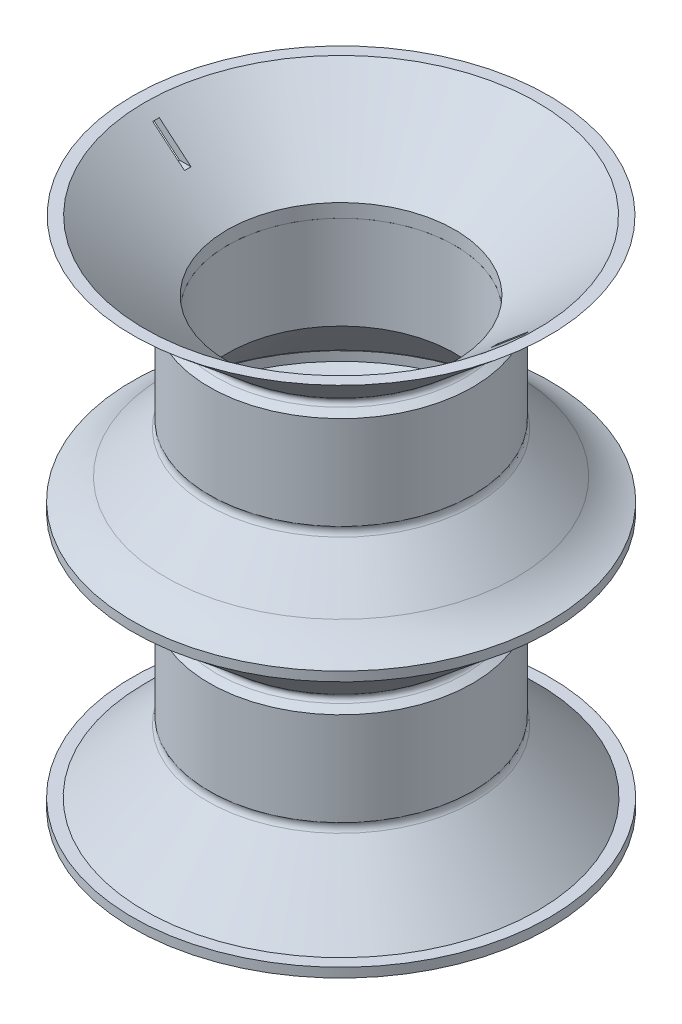
from build123d import *

# Parameters (mm, degrees)
ACTIVE_FILLET_R     = 0.5
SKETCH11_R          = 14.103676921920666
SKETCH11_R_2        = 12.180725781348816
COLLAR_DEPTH        = 10
PASSIVE_FILLET_R    = 0.8
SKETCH15_R          = 22.29457906148835
SKETCH15_R_2        = 19.722102711916126
BOSS_EXTRUDE2_DEPTH = 1
SKETCH18_W          = 3.727866184859466
SKETCH18_H          = 0.7
CIRPATTERN1_COUNT   = 2
FILLET1_R           = 10


with BuildPart() as part:
    # Sketch1 → Main Active (revolve)
    with BuildSketch(Plane.XY):
        Polygon((-0.44430417046757187, 0), (-9.97833291122136, 8), (-8.733753849733018, 8), (0.08552036891816808, 0.5997502558785777), (0.08552036891816808, -0.8481847341285212), (-1.8374307716536824, -0.8481847341285211), align=None)
    revolve(axis=Axis((12.266246150266982, 7.609018032819944, 0), (1.1e-16, -1, 0)))

    # Active fillet
    active_fillet_edges = [part.edges().sort_by_distance(p)[0] for p in [
        (24.976796471001535, 3.23e-15, -1.56e-15),
    ]]
    fillet(active_fillet_edges, radius=ACTIVE_FILLET_R)

    # Cut-Sweep2: sweep along a path in Sketch19
    with BuildLine(Plane(origin=(-0.18357578046802644, -0.2187770958860591, 2e-17), x_dir=(-0.7660444431189819, 0.6427876096865347, 0), z_dir=(-0.6427876096865347, -0.7660444431189819, 0))) as cut_sweep2_path:
        Line((11.230423528864234, 1.22e-15), (6.789896246932316, 1.18e-15))
    # Sketch18 → Cut-Sweep2 (sweep, cut)
    with BuildSketch(Plane(origin=(-8e-16, 7.000000000000001, 0), x_dir=(1, 1.1e-16, 0), z_dir=(-1.1e-16, 1, 0))):
        with Locations((-8.450194980560173, 0)):
            Rectangle(SKETCH18_W, SKETCH18_H)
    cut_sweep2 = sweep(path=cut_sweep2_path.line, mode=Mode.SUBTRACT)

    # CirPattern1: Cut-Sweep2 ×2 about axis
    cirpattern1_axis = Axis((12.266246150266982, 8.000000000000002, 0), (-1.1e-16, 1, 0))
    for i in range(1, CIRPATTERN1_COUNT):
        add(cut_sweep2.rotate(cirpattern1_axis, i * 360 / CIRPATTERN1_COUNT), mode=Mode.SUBTRACT)


with BuildPart() as body_2:
    # Sketch11 → collar (new body)
    with BuildSketch(Plane.XZ.offset(0.848184734128521)):
        with Locations((12.266246150266984, 0)):
            Circle(SKETCH11_R)
        with Locations((12.266246150266984, 0)):
            Circle(SKETCH11_R_2, mode=Mode.SUBTRACT)
    extrude(amount=COLLAR_DEPTH)

    # Sketch14 → Passive Element (revolve)
    with BuildSketch(Plane.XY, mode=Mode.PRIVATE) as passive_element_sk:
        Polygon((-1.1589875659701498, -10.848184734128521), (-8.766364496537454, -18.455561664695857), (-7.521856561649136, -18.45556166469586), (0.08552036891816897, -10.848184734128521), align=None)
    revolve(passive_element_sk.sketch.rotate(Axis((12.266246150266984, -19.969844330252183, 0), (-1.2e-16, 1, 0)), 180), axis=Axis((12.266246150266984, -19.969844330252183, 0), (-1.2e-16, 1, 0)))

    # Passive Fillet
    # the kernel refuses this fillet: 0.8 mm, written as the material it adds along each edge
    with BuildSketch(Plane(origin=(12.266246150266982, -10.84818473412852, 0), x_dir=(1, 1.3e-16, 1.2e-16), z_dir=(-1.2e-16, 0, 1))) as passive_fillet_piece_1:
        with BuildLine():
            CenterArc((14.848517187625331, -0.2919126214897238), PASSIVE_FILLET_R, 158.5991389184753, 66.40086108152457)
            Line((14.282831762676091, -0.8575980464389606), (14.271518054177106, -0.8689117549379458))
            Line((14.271518054177106, -0.8689117549379458), (13.413920007738147, -0.01131370849898516))
            Line((13.413920007738147, -0.01131370849898516), (13.425233716237132, 0.01600000000000001))
            ThreePointArc((13.425233716237132, 0.01600000000000001), (13.764455319078897, 0.01599999999999997), (14.08878011660657, 0.00583825242979499))
            Line((14.08878011660657, 0.00583825242979499), (14.103676921920664, -9e-17))
        make_face()
    revolve(axis=Axis((12.266246150266982, -10.84818473412852, 0), (-1.2e-16, 1, 0)))

    # Sketch15 → Boss-Extrude2 (add)
    with BuildSketch(Plane.XZ.offset(18.455561664695857)):
        with Locations((12.266246150266984, 0)):
            Circle(SKETCH15_R)
        with Locations((12.266246150266984, 0)):
            Circle(SKETCH15_R_2, mode=Mode.SUBTRACT)
    extrude(amount=BOSS_EXTRUDE2_DEPTH)


with BuildPart() as body_3:
    # Body-Move/Copy2: read off the stored shape, not the designer's step
    # Body-Move/Copy2: copy of body 2
    add(body_2.part.moved(Location((0, 27.45, 0))))

    # Fillet1
    # the kernel refuses this fillet: 10 mm, written as the material it adds along each edge
    with BuildSketch(Plane(origin=(12.266246150266984, 8.994438335304146, 0), x_dir=(1, 1.7e-16, 1.2e-16), z_dir=(-1.2e-16, 0, 1))) as fillet1_piece_1:
        with BuildLine():
            CenterArc((25.81484706108966, 9.359899209445736), FILLET1_R, 224.9999999999999, 24.388666535893208)
            Line((18.743779249224175, 2.2888313975802714), (18.602357892986863, 2.147410041342962))
            Line((18.602357892986863, 2.147410041342962), (20.89118929056713, -0.14142135623731097))
            Line((20.89118929056713, -0.14142135623731097), (21.03261064680444, -0.20000000000000107))
            ThreePointArc((21.03261064680444, -0.20000000000000107), (21.663594854146393, -0.20000000000000118), (22.224173701496323, -0.1871979841889184))
            Line((22.224173701496323, -0.1871979841889184), (22.294579061488346, -3.77e-15))
        make_face()
    revolve(axis=Axis((12.266246150266984, 8.994438335304146, 0), (-1.2e-16, 1, 0)))


with BuildPart() as body_4:
    # Body-Move_Copy2 2: copy of part
    add(part.part.moved(Location((0, 27.45, 0))))


solid = Compound([part.part, body_2.part, body_3.part, body_4.part])
